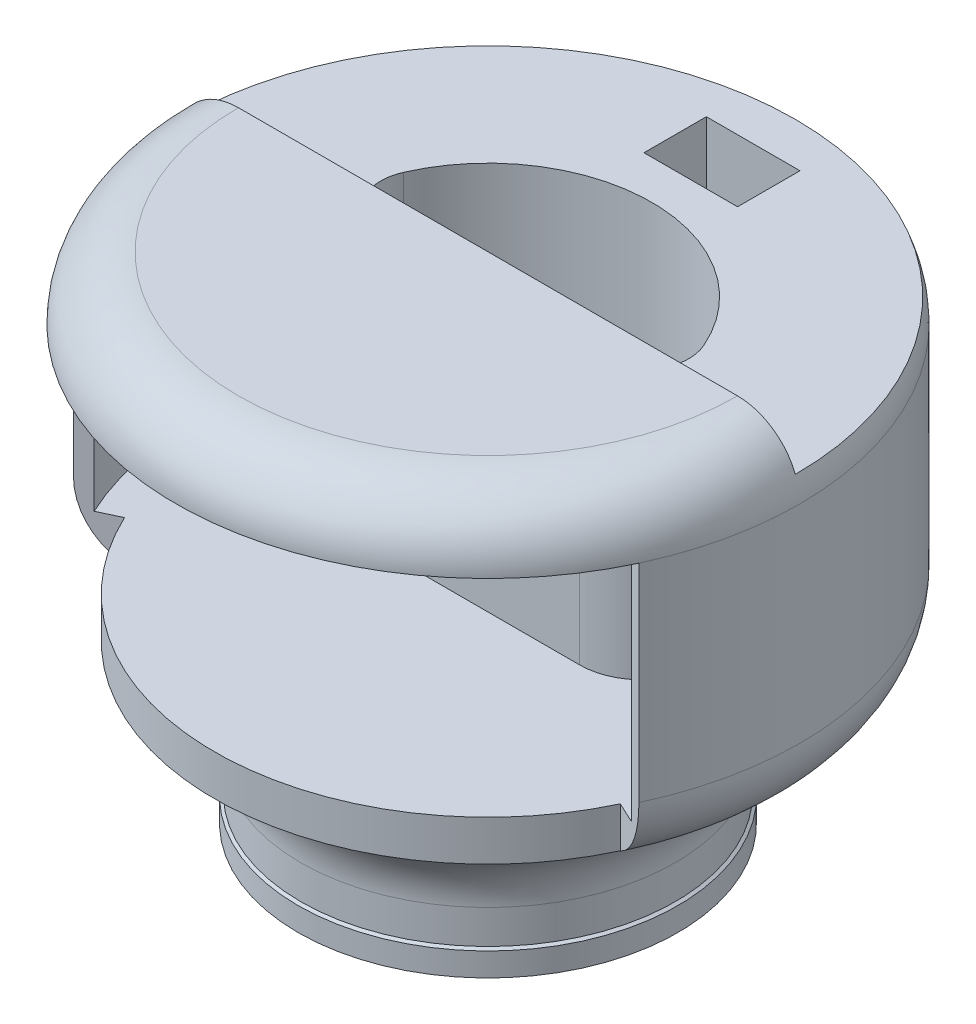
from build123d import *

# Parameters (mm, degrees)
CUT_EXTRUDE3_DEPTH           = 60
CUT_EXTRUDE5_DEPTH           = 2
CUT_EXTRUDE5_DEPTH_BACK      = 30
SKETCH9_R                    = 38
SKETCH9_R_2                  = 23
SKETCH19_W                   = 12
SKETCH19_H                   = 36.5
CUT_REVOLVE2_ANGLE           = 65
CUT_REVOLVE2_OTHER_WAY_ANGLE = 65
SKETCH21_W                   = 3.25
SKETCH21_H                   = 4
BOSS_EXTRUDE3_DEPTH          = 1.35
CIRPATTERN1_COUNT            = 5
CUT_EXTRUDE9_START           = -5
CUT_EXTRUDE9_DEPTH           = 5
SKETCH23_R                   = 10.5
CUT_EXTRUDE10_DEPTH          = 10
SKETCH24_W                   = 17
SKETCH24_H                   = 12
BOSS_EXTRUDE4_DEPTH          = 8
SKETCH26_W                   = 12
SKETCH26_H                   = 8
CUT_EXTRUDE11_DEPTH          = 10
SKETCH27_W                   = 4
SKETCH27_H                   = 5
CUT_EXTRUDE12_DEPTH          = 5
CUT_EXTRUDE14_DEPTH          = 2
CUT_EXTRUDE14_DEPTH_BACK     = 30
SKETCH29_R                   = 1
CUT_EXTRUDE15_DEPTH          = 15
FILLET1_R                    = 6
FILLET2_R                    = 8


with BuildPart() as part:
    # Sketch1 → Revolve1 (revolve)
    with BuildSketch(Plane.XY):
        with BuildLine():
            Line((0, 63.427876097), (32, 63.427876097))
            ThreePointArc((32, 63.427876097), (37.656854249, 61.084730346), (40, 55.427876097))
            Line((40, 55.427876097), (40, 28.846818009))
            ThreePointArc((40, 28.846818009), (38.792081772, 24.082439968), (35.460140376, 20.469057744))
            Line((35.460140376, 20.469057744), (28.539859624, 15.958818353))
            ThreePointArc((28.539859624, 15.958818353), (25.207918228, 12.345436129), (24, 7.581058088))
            Line((24, 7.581058088), (24, 3.25))
            Line((24, 3.25), (24.35, 3))
            Line((24.35, 3), (24.35, 0))
            Line((24.35, 0), (22.5, 0))
            Line((22.5, 0), (22.5, 12.5))
            ThreePointArc((22.5, 12.5), (22.353553391, 12.853553391), (22, 13))
            Line((22, 13), (0, 13))
            Line((0, 13), (0, 63.427876097))
        make_face()
    revolve(axis=Axis((0, 0, 0), (0, 1, 0)))

    # Sketch11 → Cut-Extrude3 (cut)
    with BuildSketch(Plane(origin=(0, 13, 0), x_dir=(-1, 0, 0), z_dir=(0, -1, 0))):
        with BuildLine():
            Line((-21, 0), (21, 0))
            ThreePointArc((21, 0), (0, 21), (-21, 0))
        make_face()
    extrude(amount=-CUT_EXTRUDE3_DEPTH, mode=Mode.SUBTRACT)

    # Sketch9 → Cut-Extrude5 (cut, two sides: drawn at the far end of the back side and taken through both)
    with BuildSketch(Plane(origin=(0, 55.427876097, 0), x_dir=(1, 0, 0), z_dir=(0, 1, 0)).offset(-CUT_EXTRUDE5_DEPTH_BACK)):
        Circle(SKETCH9_R)
        Circle(SKETCH9_R_2, mode=Mode.SUBTRACT)
    extrude(amount=CUT_EXTRUDE5_DEPTH + CUT_EXTRUDE5_DEPTH_BACK, mode=Mode.SUBTRACT)

    # Sketch19 → Cut-Revolve2 (revolve, cut)
    with BuildSketch(Plane(origin=(0, 0, 0), x_dir=(0, 0, -1), z_dir=(1, 0, 0))):
        with Locations((-41.064715832, 37.177876097)):
            Rectangle(SKETCH19_W, SKETCH19_H)
    revolve(axis=Axis((0, 0, 0), (0, 1, 0)), revolution_arc=CUT_REVOLVE2_ANGLE, mode=Mode.SUBTRACT)

    # Sketch19 → Cut-Revolve2 other way (revolve, cut)
    with BuildSketch(Plane(origin=(0, 0, 0), x_dir=(0, 0, -1), z_dir=(1, 0, 0))):
        with Locations((-41.064715832, 37.177876097)):
            Rectangle(SKETCH19_W, SKETCH19_H)
    revolve(axis=Axis((0, 0, 0), (0, -1, 0)), revolution_arc=CUT_REVOLVE2_OTHER_WAY_ANGLE, mode=Mode.SUBTRACT)

    # Sketch21 → Boss-Extrude3 (add)
    with BuildSketch(Plane(origin=(0, 0, 22.5), x_dir=(-1, 0, 0), z_dir=(0, 0, -1))):
        with Locations((0, 2)):
            Rectangle(SKETCH21_W, SKETCH21_H)
    boss_extrude3 = extrude(amount=BOSS_EXTRUDE3_DEPTH)

    # CirPattern1: Boss-Extrude3 ×5 about axis
    cirpattern1_axis = Axis((0, 0, 0), (0, -1, 0))
    for i in range(1, CIRPATTERN1_COUNT):
        add(boss_extrude3.rotate(cirpattern1_axis, i * 360 / CIRPATTERN1_COUNT))

    # Sketch22 → Cut-Extrude9 (cut)
    with BuildSketch(Plane(origin=(0, 63.427876097, 0), x_dir=(1, 0, 0), z_dir=(0, 1, 0)).offset(CUT_EXTRUDE9_START)):
        with BuildLine():
            Line((-40, 0), (40, 0))
            ThreePointArc((40, 0), (0, 40), (-40, 0))
        make_face()
    extrude(amount=CUT_EXTRUDE9_DEPTH, mode=Mode.SUBTRACT)

    # Sketch23 → Cut-Extrude10 (cut)
    with BuildSketch(Plane(origin=(0, 0, -40), x_dir=(-1, 0, 0), z_dir=(0, 0, -1))):
        with Locations((0, 42.137876097)):
            Circle(SKETCH23_R)
    extrude(amount=-CUT_EXTRUDE10_DEPTH, mode=Mode.SUBTRACT)

    # Sketch24 → Boss-Extrude4 (add)
    with BuildSketch(Plane(origin=(0, 58.427876097, 0), x_dir=(1, 0, 0), z_dir=(0, 1, 0))):
        with Locations((0, 30)):
            Rectangle(SKETCH24_W, SKETCH24_H)
    extrude(amount=-BOSS_EXTRUDE4_DEPTH)

    # Sketch26 → Cut-Extrude11 (cut)
    with BuildSketch(Plane(origin=(0, 58.427876097, 0), x_dir=(1, 0, 0), z_dir=(0, 1, 0))):
        with Locations((0, 30)):
            Rectangle(SKETCH26_W, SKETCH26_H)
    extrude(amount=-CUT_EXTRUDE11_DEPTH, mode=Mode.SUBTRACT)

    # Sketch27 → Cut-Extrude12 (cut)
    with BuildSketch(Plane(origin=(8.5, 0, 0), x_dir=(0, 0, -1), z_dir=(1, 0, 0))):
        with Locations((31, 53.927876097)):
            Rectangle(SKETCH27_W, SKETCH27_H)
    extrude(amount=-CUT_EXTRUDE12_DEPTH, mode=Mode.SUBTRACT)

    # Sketch28 → Cut-Extrude14 (cut, two sides: drawn at the far end of the back side and taken through both)
    with BuildSketch(Plane(origin=(0, 55.427876097, 0), x_dir=(1, 0, 0), z_dir=(0, 1, 0)).offset(-CUT_EXTRUDE14_DEPTH_BACK)):
        with BuildLine():
            Line((-22.912878475, -2), (22.912878475, -2))
            ThreePointArc((22.912878475, -2), (0, -23), (-22.912878475, -2))
        make_face()
    extrude(amount=CUT_EXTRUDE14_DEPTH + CUT_EXTRUDE14_DEPTH_BACK, mode=Mode.SUBTRACT)

    # Sketch29 → Cut-Extrude15 (cut)
    with BuildSketch(Plane(origin=(0, 0, 0), x_dir=(-1, 0, 0), z_dir=(0, 0, -1))):
        with Locations((-30.416198487, 60.927876097)):
            Circle(SKETCH29_R)
        with Locations((30.416198487, 60.927876097)):
            Circle(SKETCH29_R)
        with Locations((0, 60.927876097)):
            Circle(SKETCH29_R)
    extrude(amount=-CUT_EXTRUDE15_DEPTH, mode=Mode.SUBTRACT)

    # Fillet1
    fillet1_edges = [part.edges().sort_by_distance(p)[0] for p in [
        (-21, 35.713938048, 0),
        (21, 35.713938048, 0),
    ]]
    fillet(fillet1_edges, radius=FILLET1_R)

    # Fillet2
    fillet2_edges = [part.edges().sort_by_distance(p)[0] for p in [
        (22.912878475, 41.427876097, 2),
        (-22.912878475, 41.427876097, 2),
    ]]
    fillet(fillet2_edges, radius=FILLET2_R)


solid = part.part
